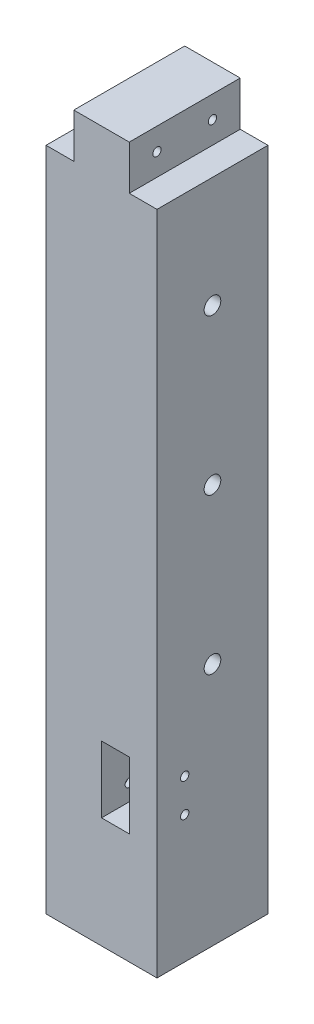
from build123d import *

# Parameters (mm, degrees)
BOSS_EXTRUDE1_DEPTH = 127
SKETCH2_W           = 31.75
SKETCH2_H           = 76.2
CUT_EXTRUDE1_DEPTH  = 63.5
SKETCH3_W           = 31.75
SKETCH3_H           = 76.2
CUT_EXTRUDE3_DEPTH  = 63.246
SKETCH4_R           = 9.525
CUT_EXTRUDE4_DEPTH  = 468.663597044
SKETCH5_R           = 4.7625
CUT_EXTRUDE5_DEPTH  = 69.85
SKETCH6_R           = 4.7625
CUT_EXTRUDE6_DEPTH  = 69.85
SKETCH7_R           = 4.7625
CUT_EXTRUDE7_DEPTH  = 461.057390442


with BuildPart() as part:
    # Sketch1 → Boss-Extrude1 (new body)
    with BuildSketch(Plane.XY):
        Polygon((63.5, -381), (63.5, 381), (31.75, 381), (31.75, 431.8), (-31.75, 431.8), (-31.75, 381), (-63.5, 381), (-63.5, -381), align=None)
    extrude(amount=BOSS_EXTRUDE1_DEPTH)

    # Sketch2 → Cut-Extrude1 (cut)
    with BuildSketch(Plane.XY.offset(127)):
        with Locations((15.875, -215.9)):
            Rectangle(SKETCH2_W, SKETCH2_H)
    extrude(amount=-CUT_EXTRUDE1_DEPTH, mode=Mode.SUBTRACT)

    # Sketch3 → Cut-Extrude3 (cut)
    with BuildSketch(Plane.ZY.offset(63.5)):
        with Locations((47.625, -215.9)):
            Rectangle(SKETCH3_W, SKETCH3_H)
    extrude(amount=-CUT_EXTRUDE3_DEPTH, mode=Mode.SUBTRACT)

    # Sketch4 → Cut-Extrude4 (cut, through all)
    with BuildSketch(Plane.ZY.offset(63.5)):
        with Locations((63.5, -101.6)):
            Circle(SKETCH4_R)
        with Locations((63.5, 76.2)):
            Circle(SKETCH4_R)
        with Locations((63.5, 254)):
            Circle(SKETCH4_R)
    extrude(amount=-CUT_EXTRUDE4_DEPTH, mode=Mode.SUBTRACT)

    # Sketch5 → Cut-Extrude5 (cut)
    with BuildSketch(Plane(origin=(0, 0, 0), x_dir=(-1, 0, 0), z_dir=(0, 0, -1))):
        with Locations((31.75, -196.85)):
            Circle(SKETCH5_R)
        with Locations((31.75, -234.95)):
            Circle(SKETCH5_R)
    extrude(amount=-CUT_EXTRUDE5_DEPTH, mode=Mode.SUBTRACT)

    # Sketch6 → Cut-Extrude6 (cut)
    with BuildSketch(Plane(origin=(63.5, 0, 0), x_dir=(0, 0, -1), z_dir=(1, 0, 0))):
        with Locations((-95.25, -196.85)):
            Circle(SKETCH6_R)
        with Locations((-95.25, -234.95)):
            Circle(SKETCH6_R)
    extrude(amount=-CUT_EXTRUDE6_DEPTH, mode=Mode.SUBTRACT)

    # Sketch7 → Cut-Extrude7 (cut, through all)
    with BuildSketch(Plane(origin=(31.75, 0, 0), x_dir=(0, 0, -1), z_dir=(1, 0, 0))):
        with Locations((-95.25, 406.4)):
            Circle(SKETCH7_R)
        with Locations((-31.75, 406.4)):
            Circle(SKETCH7_R)
    extrude(amount=-CUT_EXTRUDE7_DEPTH, mode=Mode.SUBTRACT)


solid = part.part
